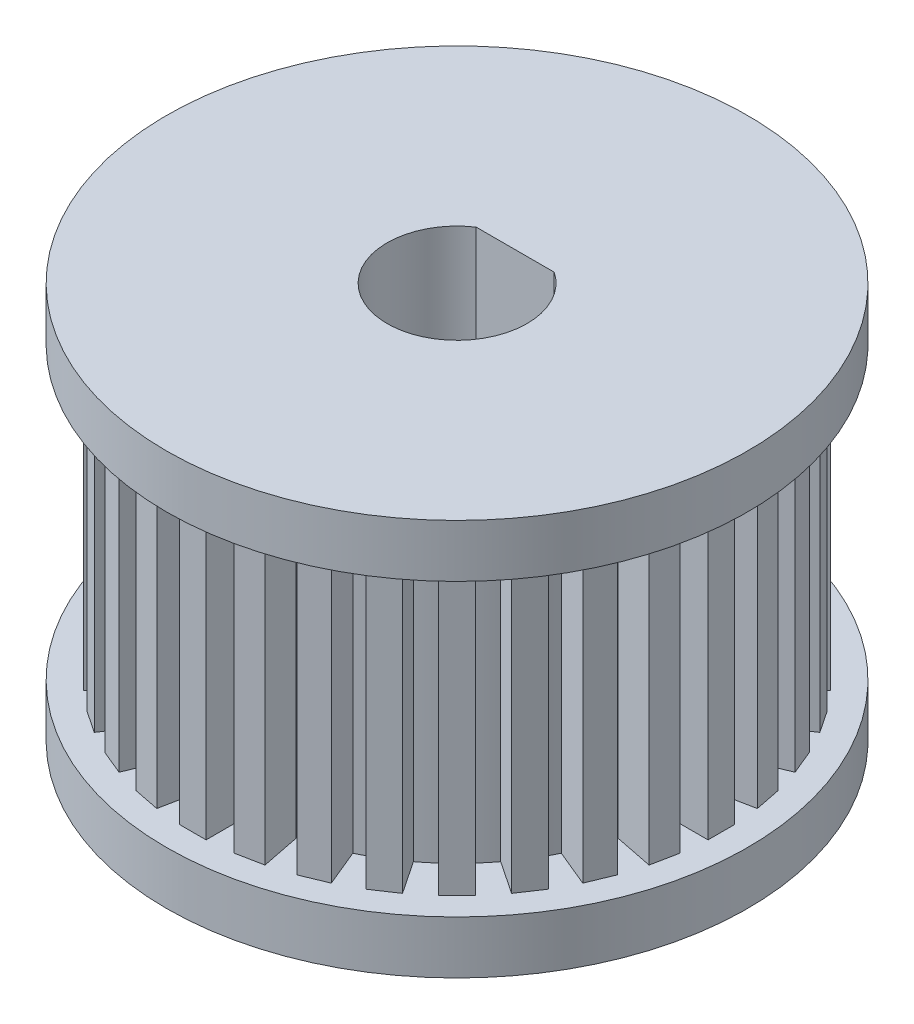
from build123d import *

# Parameters (mm, degrees)
BOSS_EXTRUDE1_DEPTH = 15
SKETCH1_4_R         = 11
SKETCH1_4_R_2       = 8.514693183
BOSS_EXTRUDE2_DEPTH = 2
BOSS_EXTRUDE3_START = 13
SKETCH1_5_R         = 11
SKETCH1_5_R_2       = 8.514693183
BOSS_EXTRUDE3_DEPTH = 2


with BuildPart() as part:
    # Sketch1 → Boss-Extrude1 (new body)
    with BuildSketch(Plane(origin=(0, 0, 0), x_dir=(1, 0, 0), z_dir=(0, 1, 0))):
        with BuildLine():
            ThreePointArc((-2.148660377, 8.239129722), (-1.661134235, 8.351085741), (-1.167875097, 8.434220044))
            Line((-1.167875097, 8.434220044), (-1.46051058, 9.905397965))
            Line((-1.46051058, 9.905397965), (-2.44129586, 9.710307643))
            Line((-2.44129586, 9.710307643), (-2.148660377, 8.239129722))
        make_face()
        with BuildLine():
            ThreePointArc((-3.714748941, 7.66163431), (-3.258432013, 7.866550757), (-2.790869409, 8.044317743))
            Line((-2.790869409, 8.044317743), (-3.364894557, 9.430137041))
            Line((-3.364894557, 9.430137041), (-4.28877409, 9.047453609))
            Line((-4.28877409, 9.047453609), (-3.714748941, 7.66163431))
        make_face()
        with BuildLine():
            ThreePointArc((-5.138081787, 6.789706588), (-4.730510076, 7.07970864), (-4.306612175, 7.345276821))
            Line((-4.306612175, 7.345276821), (-5.139967524, 8.59248124))
            Line((-5.139967524, 8.59248124), (-5.971437136, 8.036911007))
            Line((-5.971437136, 8.036911007), (-5.138081787, 6.789706588))
        make_face()
        with BuildLine():
            ThreePointArc((-6.363961031, 5.656854249), (-6.020797289, 6.020797289), (-5.656854249, 6.363961031))
            Line((-5.656854249, 6.363961031), (-6.717514421, 7.424621202))
            Line((-6.717514421, 7.424621202), (-7.424621202, 6.717514421))
            Line((-7.424621202, 6.717514421), (-6.363961031, 5.656854249))
        make_face()
        with BuildLine():
            ThreePointArc((-7.345276821, 4.306612175), (-7.07970864, 4.730510076), (-6.789706588, 5.138081787))
            Line((-6.789706588, 5.138081787), (-8.036911007, 5.971437136))
            Line((-8.036911007, 5.971437136), (-8.59248124, 5.139967524))
            Line((-8.59248124, 5.139967524), (-7.345276821, 4.306612175))
        make_face()
        with BuildLine():
            ThreePointArc((-8.044317743, 2.790869409), (-7.866550757, 3.258432013), (-7.66163431, 3.714748941))
            Line((-7.66163431, 3.714748941), (-9.047453609, 4.28877409))
            Line((-9.047453609, 4.28877409), (-9.430137041, 3.364894557))
            Line((-9.430137041, 3.364894557), (-8.044317743, 2.790869409))
        make_face()
        with BuildLine():
            ThreePointArc((-8.434220044, 1.167875097), (-8.351085741, 1.661134235), (-8.239129722, 2.148660377))
            Line((-8.239129722, 2.148660377), (-9.710307643, 2.44129586))
            Line((-9.710307643, 2.44129586), (-9.905397965, 1.46051058))
            Line((-9.905397965, 1.46051058), (-8.434220044, 1.167875097))
        make_face()
        with BuildLine():
            ThreePointArc((-8.5, -0.5), (-8.514693183, 0), (-8.5, 0.5))
            Line((-8.5, 0.5), (-10, 0.5))
            Line((-10, 0.5), (-10, -0.5))
            Line((-10, -0.5), (-8.5, -0.5))
        make_face()
        with BuildLine():
            Line((-9.710307643, -2.44129586), (-8.239129722, -2.148660377))
            ThreePointArc((-8.239129722, -2.148660377), (-8.351085741, -1.661134235), (-8.434220044, -1.167875097))
            Line((-8.434220044, -1.167875097), (-9.905397965, -1.46051058))
            Line((-9.905397965, -1.46051058), (-9.710307643, -2.44129586))
        make_face()
        with BuildLine():
            Line((-9.047453609, -4.28877409), (-7.66163431, -3.714748941))
            ThreePointArc((-7.66163431, -3.714748941), (-7.866550757, -3.258432013), (-8.044317743, -2.790869409))
            Line((-8.044317743, -2.790869409), (-9.430137041, -3.364894557))
            Line((-9.430137041, -3.364894557), (-9.047453609, -4.28877409))
        make_face()
        with BuildLine():
            Line((-8.036911007, -5.971437136), (-6.789706588, -5.138081787))
            ThreePointArc((-6.789706588, -5.138081787), (-7.07970864, -4.730510076), (-7.345276821, -4.306612175))
            Line((-7.345276821, -4.306612175), (-8.59248124, -5.139967524))
            Line((-8.59248124, -5.139967524), (-8.036911007, -5.971437136))
        make_face()
        with BuildLine():
            Line((-6.717514421, -7.424621202), (-5.656854249, -6.363961031))
            ThreePointArc((-5.656854249, -6.363961031), (-6.020797289, -6.020797289), (-6.363961031, -5.656854249))
            Line((-6.363961031, -5.656854249), (-7.424621202, -6.717514421))
            Line((-7.424621202, -6.717514421), (-6.717514421, -7.424621202))
        make_face()
        with BuildLine():
            Line((-5.139967524, -8.59248124), (-4.306612175, -7.345276821))
            ThreePointArc((-4.306612175, -7.345276821), (-4.730510076, -7.07970864), (-5.138081787, -6.789706588))
            Line((-5.138081787, -6.789706588), (-5.971437136, -8.036911007))
            Line((-5.971437136, -8.036911007), (-5.139967524, -8.59248124))
        make_face()
        with BuildLine():
            Line((-3.364894557, -9.430137041), (-2.790869409, -8.044317743))
            ThreePointArc((-2.790869409, -8.044317743), (-3.258432013, -7.866550757), (-3.714748941, -7.66163431))
            Line((-3.714748941, -7.66163431), (-4.28877409, -9.047453609))
            Line((-4.28877409, -9.047453609), (-3.364894557, -9.430137041))
        make_face()
        with BuildLine():
            Line((-1.46051058, -9.905397965), (-1.167875097, -8.434220044))
            ThreePointArc((-1.167875097, -8.434220044), (-1.661134235, -8.351085741), (-2.148660377, -8.239129722))
            Line((-2.148660377, -8.239129722), (-2.44129586, -9.710307643))
            Line((-2.44129586, -9.710307643), (-1.46051058, -9.905397965))
        make_face()
        with BuildLine():
            Line((1.46051058, 9.905397965), (1.167875097, 8.434220044))
            ThreePointArc((1.167875097, 8.434220044), (1.661134235, 8.351085741), (2.148660377, 8.239129722))
            Line((2.148660377, 8.239129722), (2.44129586, 9.710307643))
            Line((2.44129586, 9.710307643), (1.46051058, 9.905397965))
        make_face()
        with BuildLine():
            Line((3.364894557, 9.430137041), (2.790869409, 8.044317743))
            ThreePointArc((2.790869409, 8.044317743), (3.258432013, 7.866550757), (3.714748941, 7.66163431))
            Line((3.714748941, 7.66163431), (4.28877409, 9.047453609))
            Line((4.28877409, 9.047453609), (3.364894557, 9.430137041))
        make_face()
        with BuildLine():
            Line((5.139967524, 8.59248124), (4.306612175, 7.345276821))
            ThreePointArc((4.306612175, 7.345276821), (4.730510076, 7.07970864), (5.138081787, 6.789706588))
            Line((5.138081787, 6.789706588), (5.971437136, 8.036911007))
            Line((5.971437136, 8.036911007), (5.139967524, 8.59248124))
        make_face()
        with BuildLine():
            Line((6.717514421, 7.424621202), (5.656854249, 6.363961031))
            ThreePointArc((5.656854249, 6.363961031), (6.020797289, 6.020797289), (6.363961031, 5.656854249))
            Line((6.363961031, 5.656854249), (7.424621202, 6.717514421))
            Line((7.424621202, 6.717514421), (6.717514421, 7.424621202))
        make_face()
        with BuildLine():
            Line((8.036911007, 5.971437136), (6.789706588, 5.138081787))
            ThreePointArc((6.789706588, 5.138081787), (7.07970864, 4.730510076), (7.345276821, 4.306612175))
            Line((7.345276821, 4.306612175), (8.59248124, 5.139967524))
            Line((8.59248124, 5.139967524), (8.036911007, 5.971437136))
        make_face()
        with BuildLine():
            Line((9.047453609, 4.28877409), (7.66163431, 3.714748941))
            ThreePointArc((7.66163431, 3.714748941), (7.866550757, 3.258432013), (8.044317743, 2.790869409))
            Line((8.044317743, 2.790869409), (9.430137041, 3.364894557))
            Line((9.430137041, 3.364894557), (9.047453609, 4.28877409))
        make_face()
        with BuildLine():
            Line((9.710307643, 2.44129586), (8.239129722, 2.148660377))
            ThreePointArc((8.239129722, 2.148660377), (8.351085741, 1.661134235), (8.434220044, 1.167875097))
            Line((8.434220044, 1.167875097), (9.905397965, 1.46051058))
            Line((9.905397965, 1.46051058), (9.710307643, 2.44129586))
        make_face()
        with BuildLine():
            Line((10, 0.5), (8.5, 0.5))
            ThreePointArc((8.5, 0.5), (8.511019095, 0.250107922), (8.514693183, 0))
            ThreePointArc((8.514693183, 0), (8.511019095, -0.250107922), (8.5, -0.5))
            Line((8.5, -0.5), (10, -0.5))
            Line((10, -0.5), (10, 0.5))
        make_face()
        with BuildLine():
            ThreePointArc((8.434220044, -1.167875097), (8.351085741, -1.661134235), (8.239129722, -2.148660377))
            Line((8.239129722, -2.148660377), (9.710307643, -2.44129586))
            Line((9.710307643, -2.44129586), (9.905397965, -1.46051058))
            Line((9.905397965, -1.46051058), (8.434220044, -1.167875097))
        make_face()
        with BuildLine():
            ThreePointArc((8.044317743, -2.790869409), (7.866550757, -3.258432013), (7.66163431, -3.714748941))
            Line((7.66163431, -3.714748941), (9.047453609, -4.28877409))
            Line((9.047453609, -4.28877409), (9.430137041, -3.364894557))
            Line((9.430137041, -3.364894557), (8.044317743, -2.790869409))
        make_face()
        with BuildLine():
            ThreePointArc((7.345276821, -4.306612175), (7.07970864, -4.730510076), (6.789706588, -5.138081787))
            Line((6.789706588, -5.138081787), (8.036911007, -5.971437136))
            Line((8.036911007, -5.971437136), (8.59248124, -5.139967524))
            Line((8.59248124, -5.139967524), (7.345276821, -4.306612175))
        make_face()
        with BuildLine():
            ThreePointArc((6.363961031, -5.656854249), (6.020797289, -6.020797289), (5.656854249, -6.363961031))
            Line((5.656854249, -6.363961031), (6.717514421, -7.424621202))
            Line((6.717514421, -7.424621202), (7.424621202, -6.717514421))
            Line((7.424621202, -6.717514421), (6.363961031, -5.656854249))
        make_face()
        with BuildLine():
            ThreePointArc((5.138081787, -6.789706588), (4.730510076, -7.07970864), (4.306612175, -7.345276821))
            Line((4.306612175, -7.345276821), (5.139967524, -8.59248124))
            Line((5.139967524, -8.59248124), (5.971437136, -8.036911007))
            Line((5.971437136, -8.036911007), (5.138081787, -6.789706588))
        make_face()
        with BuildLine():
            ThreePointArc((3.714748941, -7.66163431), (3.258432013, -7.866550757), (2.790869409, -8.044317743))
            Line((2.790869409, -8.044317743), (3.364894557, -9.430137041))
            Line((3.364894557, -9.430137041), (4.28877409, -9.047453609))
            Line((4.28877409, -9.047453609), (3.714748941, -7.66163431))
        make_face()
        with BuildLine():
            ThreePointArc((2.148660377, -8.239129722), (1.661134235, -8.351085741), (1.167875097, -8.434220044))
            Line((1.167875097, -8.434220044), (1.46051058, -9.905397965))
            Line((1.46051058, -9.905397965), (2.44129586, -9.710307643))
            Line((2.44129586, -9.710307643), (2.148660377, -8.239129722))
        make_face()
        with BuildLine():
            Line((-0.5, -10), (0, -10))
            Line((0, -10), (0, -8.514693183))
            ThreePointArc((0, -8.514693183), (-0.250107922, -8.511019095), (-0.5, -8.5))
            Line((-0.5, -8.5), (-0.5, -10))
        make_face()
        with BuildLine():
            Line((0, -8.514693183), (0, -10))
            Line((0, -10), (0.5, -10))
            Line((0.5, -10), (0.5, -8.5))
            ThreePointArc((0.5, -8.5), (0.250107922, -8.511019095), (0, -8.514693183))
        make_face()
        with BuildLine():
            Line((0, 8.514693183), (0, 10))
            Line((0, 10), (-0.5, 10))
            Line((-0.5, 10), (-0.5, 8.5))
            ThreePointArc((-0.5, 8.5), (-0.250107922, 8.511019095), (0, 8.514693183))
        make_face()
        with BuildLine():
            Line((0.5, 10), (0, 10))
            Line((0, 10), (0, 8.514693183))
            ThreePointArc((0, 8.514693183), (0.250107922, 8.511019095), (0.5, 8.5))
            Line((0.5, 8.5), (0.5, 10))
        make_face()
        with BuildLine():
            ThreePointArc((0.5, 8.5), (0.250107922, 8.511019095), (0, 8.514693183))
            Line((0, 8.514693183), (0, 2.2))
            Line((0, 2.2), (1.47732867, 2.2))
            ThreePointArc((1.47732867, 2.2), (2.535004931, -0.772172261), (0, -2.65))
            Line((0, -2.65), (0, -8.514693183))
            ThreePointArc((0, -8.514693183), (0.250107922, -8.511019095), (0.5, -8.5))
            ThreePointArc((0.5, -8.5), (0.834585877, -8.473692608), (1.167875097, -8.434220044))
            ThreePointArc((1.167875097, -8.434220044), (1.661134235, -8.351085741), (2.148660377, -8.239129722))
            ThreePointArc((2.148660377, -8.239129722), (2.471684963, -8.148053353), (2.790869409, -8.044317743))
            ThreePointArc((2.790869409, -8.044317743), (3.258432013, -7.866550757), (3.714748941, -7.66163431))
            ThreePointArc((3.714748941, -7.66163431), (4.013798582, -7.509288977), (4.306612175, -7.345276821))
            ThreePointArc((4.306612175, -7.345276821), (4.730510076, -7.07970864), (5.138081787, -6.789706588))
            ThreePointArc((5.138081787, -6.789706588), (5.401664172, -6.581946838), (5.656854249, -6.363961031))
            ThreePointArc((5.656854249, -6.363961031), (6.020797289, -6.020797289), (6.363961031, -5.656854249))
            ThreePointArc((6.363961031, -5.656854249), (6.581946838, -5.401664172), (6.789706588, -5.138081787))
            ThreePointArc((6.789706588, -5.138081787), (7.07970864, -4.730510076), (7.345276821, -4.306612175))
            ThreePointArc((7.345276821, -4.306612175), (7.509288977, -4.013798582), (7.66163431, -3.714748941))
            ThreePointArc((7.66163431, -3.714748941), (7.866550757, -3.258432013), (8.044317743, -2.790869409))
            ThreePointArc((8.044317743, -2.790869409), (8.148053353, -2.471684963), (8.239129722, -2.148660377))
            ThreePointArc((8.239129722, -2.148660377), (8.351085741, -1.661134235), (8.434220044, -1.167875097))
            ThreePointArc((8.434220044, -1.167875097), (8.473692608, -0.834585877), (8.5, -0.5))
            ThreePointArc((8.5, -0.5), (8.511019095, -0.250107922), (8.514693183, 0))
            ThreePointArc((8.514693183, 0), (8.511019095, 0.250107922), (8.5, 0.5))
            ThreePointArc((8.5, 0.5), (8.473692608, 0.834585877), (8.434220044, 1.167875097))
            ThreePointArc((8.434220044, 1.167875097), (8.351085741, 1.661134235), (8.239129722, 2.148660377))
            ThreePointArc((8.239129722, 2.148660377), (8.148053353, 2.471684963), (8.044317743, 2.790869409))
            ThreePointArc((8.044317743, 2.790869409), (7.866550757, 3.258432013), (7.66163431, 3.714748941))
            ThreePointArc((7.66163431, 3.714748941), (7.509288977, 4.013798582), (7.345276821, 4.306612175))
            ThreePointArc((7.345276821, 4.306612175), (7.07970864, 4.730510076), (6.789706588, 5.138081787))
            ThreePointArc((6.789706588, 5.138081787), (6.581946838, 5.401664172), (6.363961031, 5.656854249))
            ThreePointArc((6.363961031, 5.656854249), (6.020797289, 6.020797289), (5.656854249, 6.363961031))
            ThreePointArc((5.656854249, 6.363961031), (5.401664172, 6.581946838), (5.138081787, 6.789706588))
            ThreePointArc((5.138081787, 6.789706588), (4.730510076, 7.07970864), (4.306612175, 7.345276821))
            ThreePointArc((4.306612175, 7.345276821), (4.013798582, 7.509288977), (3.714748941, 7.66163431))
            ThreePointArc((3.714748941, 7.66163431), (3.258432013, 7.866550757), (2.790869409, 8.044317743))
            ThreePointArc((2.790869409, 8.044317743), (2.471684963, 8.148053353), (2.148660377, 8.239129722))
            ThreePointArc((2.148660377, 8.239129722), (1.661134235, 8.351085741), (1.167875097, 8.434220044))
            ThreePointArc((1.167875097, 8.434220044), (0.834585877, 8.473692608), (0.5, 8.5))
        make_face()
        with BuildLine():
            Line((0, 2.2), (0, 8.514693183))
            ThreePointArc((0, 8.514693183), (-0.250107922, 8.511019095), (-0.5, 8.5))
            ThreePointArc((-0.5, 8.5), (-0.834585877, 8.473692608), (-1.167875097, 8.434220044))
            ThreePointArc((-1.167875097, 8.434220044), (-1.661134235, 8.351085741), (-2.148660377, 8.239129722))
            ThreePointArc((-2.148660377, 8.239129722), (-2.471684963, 8.148053353), (-2.790869409, 8.044317743))
            ThreePointArc((-2.790869409, 8.044317743), (-3.258432013, 7.866550757), (-3.714748941, 7.66163431))
            ThreePointArc((-3.714748941, 7.66163431), (-4.013798582, 7.509288977), (-4.306612175, 7.345276821))
            ThreePointArc((-4.306612175, 7.345276821), (-4.730510076, 7.07970864), (-5.138081787, 6.789706588))
            ThreePointArc((-5.138081787, 6.789706588), (-5.401664172, 6.581946838), (-5.656854249, 6.363961031))
            ThreePointArc((-5.656854249, 6.363961031), (-6.020797289, 6.020797289), (-6.363961031, 5.656854249))
            ThreePointArc((-6.363961031, 5.656854249), (-6.581946838, 5.401664172), (-6.789706588, 5.138081787))
            ThreePointArc((-6.789706588, 5.138081787), (-7.07970864, 4.730510076), (-7.345276821, 4.306612175))
            ThreePointArc((-7.345276821, 4.306612175), (-7.509288977, 4.013798582), (-7.66163431, 3.714748941))
            ThreePointArc((-7.66163431, 3.714748941), (-7.866550757, 3.258432013), (-8.044317743, 2.790869409))
            ThreePointArc((-8.044317743, 2.790869409), (-8.148053353, 2.471684963), (-8.239129722, 2.148660377))
            ThreePointArc((-8.239129722, 2.148660377), (-8.351085741, 1.661134235), (-8.434220044, 1.167875097))
            ThreePointArc((-8.434220044, 1.167875097), (-8.473692608, 0.834585877), (-8.5, 0.5))
            ThreePointArc((-8.5, 0.5), (-8.514693183, 0), (-8.5, -0.5))
            ThreePointArc((-8.5, -0.5), (-8.473692608, -0.834585877), (-8.434220044, -1.167875097))
            ThreePointArc((-8.434220044, -1.167875097), (-8.351085741, -1.661134235), (-8.239129722, -2.148660377))
            ThreePointArc((-8.239129722, -2.148660377), (-8.148053353, -2.471684963), (-8.044317743, -2.790869409))
            ThreePointArc((-8.044317743, -2.790869409), (-7.866550757, -3.258432013), (-7.66163431, -3.714748941))
            ThreePointArc((-7.66163431, -3.714748941), (-7.509288977, -4.013798582), (-7.345276821, -4.306612175))
            ThreePointArc((-7.345276821, -4.306612175), (-7.07970864, -4.730510076), (-6.789706588, -5.138081787))
            ThreePointArc((-6.789706588, -5.138081787), (-6.581946838, -5.401664172), (-6.363961031, -5.656854249))
            ThreePointArc((-6.363961031, -5.656854249), (-6.020797289, -6.020797289), (-5.656854249, -6.363961031))
            ThreePointArc((-5.656854249, -6.363961031), (-5.401664172, -6.581946838), (-5.138081787, -6.789706588))
            ThreePointArc((-5.138081787, -6.789706588), (-4.730510076, -7.07970864), (-4.306612175, -7.345276821))
            ThreePointArc((-4.306612175, -7.345276821), (-4.013798582, -7.509288977), (-3.714748941, -7.66163431))
            ThreePointArc((-3.714748941, -7.66163431), (-3.258432013, -7.866550757), (-2.790869409, -8.044317743))
            ThreePointArc((-2.790869409, -8.044317743), (-2.471684963, -8.148053353), (-2.148660377, -8.239129722))
            ThreePointArc((-2.148660377, -8.239129722), (-1.661134235, -8.351085741), (-1.167875097, -8.434220044))
            ThreePointArc((-1.167875097, -8.434220044), (-0.834585877, -8.473692608), (-0.5, -8.5))
            ThreePointArc((-0.5, -8.5), (-0.250107922, -8.511019095), (0, -8.514693183))
            Line((0, -8.514693183), (0, -2.65))
            ThreePointArc((0, -2.65), (-2.535004931, -0.772172261), (-1.47732867, 2.2))
            Line((-1.47732867, 2.2), (0, 2.2))
        make_face()
    extrude(amount=BOSS_EXTRUDE1_DEPTH)

    # Sketch1<4> → Boss-Extrude2 (add)
    with BuildSketch(Plane(origin=(0, 0, 0), x_dir=(1, 0, 0), z_dir=(0, 1, 0))):
        with Locations(Location((0, 0, 0), (0, 0, 270))):
            Circle(SKETCH1_4_R)
        Circle(SKETCH1_4_R_2, mode=Mode.SUBTRACT)
    extrude(amount=BOSS_EXTRUDE2_DEPTH)

    # Sketch1<5> → Boss-Extrude3 (add)
    with BuildSketch(Plane(origin=(0, 0, 0), x_dir=(1, 0, 0), z_dir=(0, 1, 0)).offset(BOSS_EXTRUDE3_START)):
        with Locations(Location((0, 0, 0), (0, 0, 270))):
            Circle(SKETCH1_5_R)
        Circle(SKETCH1_5_R_2, mode=Mode.SUBTRACT)
    extrude(amount=BOSS_EXTRUDE3_DEPTH)


solid = part.part
